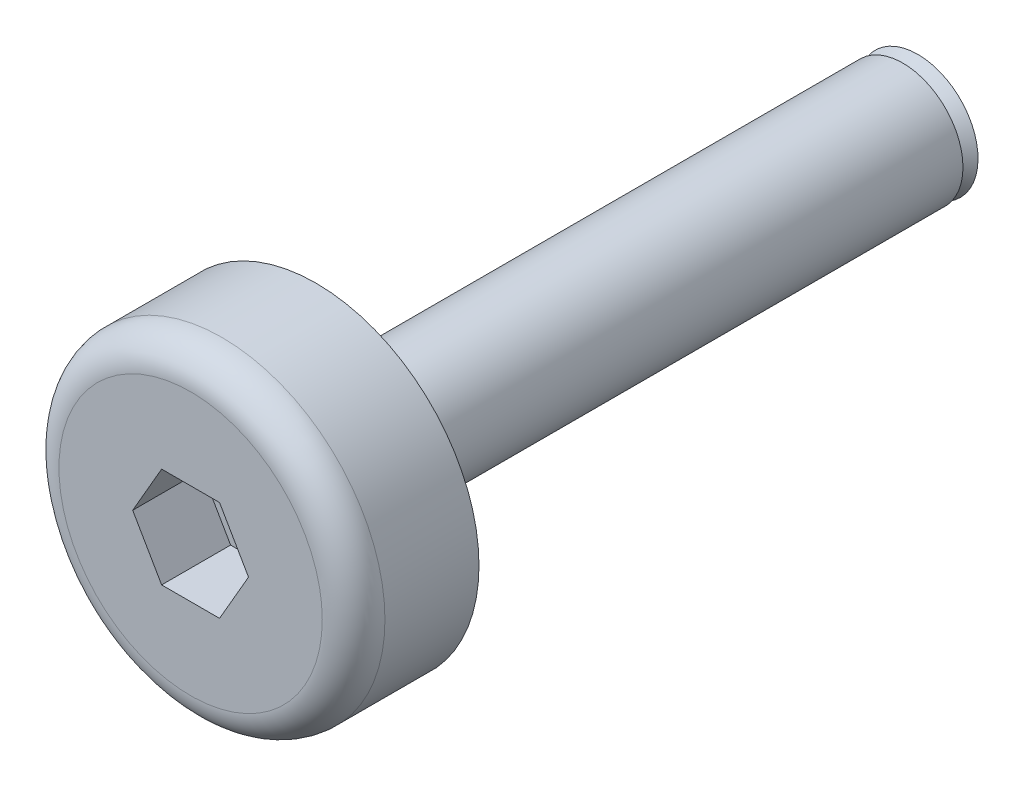
from build123d import *

# Parameters (mm, degrees)
F_0030_CYLINDER_SKETCH_R    = 3.25
F_0030_CYLINDER_DEPTH       = 2.5
F_0031_FILLET_R             = 0.625
F_0032_EXTRUDE_DEPTH        = 1.385
F_0032_EXTRUDE_ROTATE_ANGLE = 120
F_0035_CYLINDER_SKETCH_R    = 1.2
F_0035_CYLINDER_DEPTH       = 11.7
F_0036_CONE_ROTATE_ANGLE    = 90


with BuildPart() as part:
    # 0030_cylinder_Sketch → 0030_cylinder (new body)
    with BuildSketch(Plane.XY):
        Circle(F_0030_CYLINDER_SKETCH_R)
    extrude(amount=F_0030_CYLINDER_DEPTH)

    # 0031_fillet
    f_0031_fillet_edges = [part.edges().sort_by_distance(p)[0] for p in [
        (-3.25, 0, 2.5),
    ]]
    fillet(f_0031_fillet_edges, radius=F_0031_FILLET_R)


with BuildPart() as body_2:
    # 0032_extrude_Sketch → 0032_extrude (new body)
    with BuildSketch(Plane.XY):
        Polygon((0, 0), (1.154700538, 0), (1.732050808, 1), (1.154700538, 2), (0, 2), (-0.577350269, 1), align=None)
    extrude(amount=F_0032_EXTRUDE_DEPTH)


with BuildPart() as body_2_1:
    # 0032_extrude_Rotate: read off the stored shape, not the designer's step
    # 0032_extrude_Rotate: moved
    add(body_2.part.rotate(Axis((0, 0, 0), (0, 0, 1)), F_0032_EXTRUDE_ROTATE_ANGLE))


with BuildPart() as body_2_2:
    # 0032_extrude_Translate: moved
    add(body_2_1.part.moved(Location((1.154700538, 0, 1.125))))


with BuildPart() as part_1:
    add(part.part)

    # 0034_sub: cut body 2
    add(body_2_2.part, mode=Mode.SUBTRACT)


with BuildPart() as body_2_2_1:
    # 0035_cylinder_Sketch → 0035_cylinder (new body)
    with BuildSketch(Plane.XY):
        Circle(F_0035_CYLINDER_SKETCH_R)
    extrude(amount=F_0035_CYLINDER_DEPTH)


with BuildPart() as body_2_2_2:
    # 0035_cylinder_Translate: moved
    add(body_2_2_1.part.moved(Location((0, 0, -11.7))))


with BuildPart() as body_3:
    # 0036_cone_Sketch → 0036_cone (revolve)
    with BuildSketch(Plane.XY, mode=Mode.PRIVATE) as f_0036_cone_sk:
        Polygon((0, 0), (1.2, 0), (0.9, 0.3), (0, 0.3), align=None)
    revolve(f_0036_cone_sk.sketch.rotate(Axis((0, -100, 0), (0, 1, 0)), 90), axis=Axis((0, -100, 0), (0, 1, 0)))


with BuildPart() as body_3_1:
    # 0036_cone_Rotate: moved
    add(body_3.part.rotate(Axis((0, 0, 0), (1, 0, 0)), F_0036_CONE_ROTATE_ANGLE))


with BuildPart() as body_3_2:
    # 0036_cone_Translate: moved
    add(body_3_1.part.moved(Location((0, 0, -12))))


with BuildPart() as body_2_2_3:
    add(body_2_2_2.part)

    # 0038_add: union body 3
    add(body_3_2.part)


with BuildPart() as part_2:
    add(part_1.part)

    # 0039_add: union body 2 2
    add(body_2_2_3.part)


solid = part_2.part
